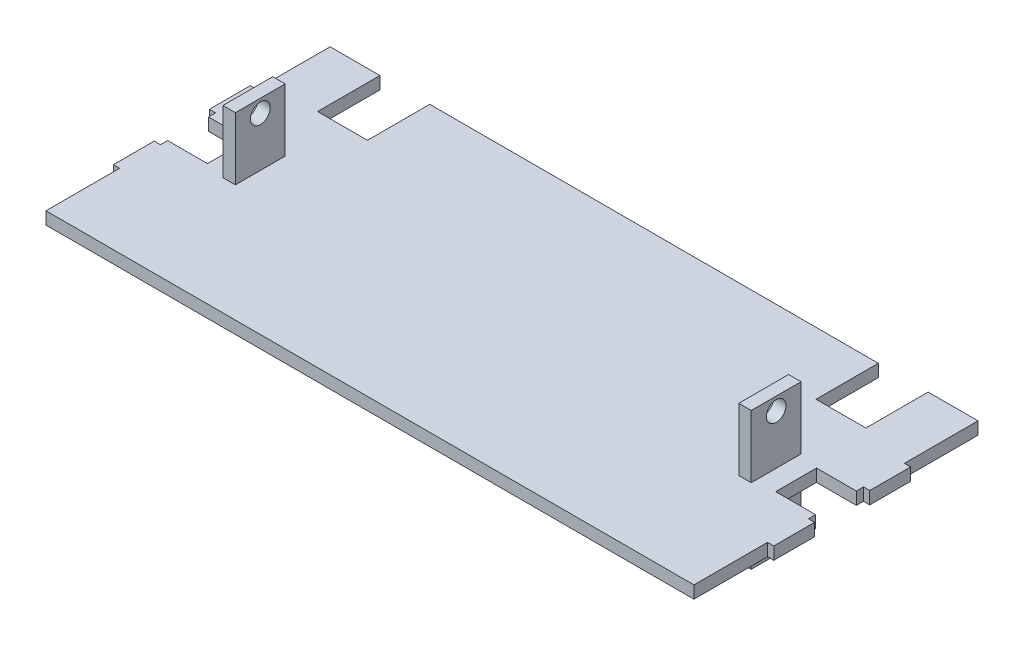
from build123d import *

# Parameters (mm, degrees)
BOSS_EXTRUDE1_DEPTH     = 3.175
SKETCH2_W               = 6.35
SKETCH2_H               = 25.4
BOSS_EXTRUDE2_DEPTH     = 35.052
CUT_EXTRUDE1_DEPTH      = 314.391665219
CUT_EXTRUDE1_DEPTH_BACK = 314.391665219
SKETCH3_R               = 5.0038


with BuildPart() as part:
    # Sketch1 → Boss-Extrude1 (new, symmetric)
    with BuildSketch(Plane(origin=(0, 0, 0), x_dir=(1, 0, 0), z_dir=(0, 1, 0))):
        Polygon((165.1, -72.39), (-165.1, -72.39), (-165.1, -34.874677354), (-168.275, -34.874677354), (-168.275, -14.046677354), (-165.1, -14.046677354), (-165.1, -10.414), (-144.78, -10.414), (-144.78, 10.414), (-165.1, 10.414), (-165.1, 14.046677354), (-168.275, 14.046677354), (-168.275, 34.874677354), (-165.1, 34.874677354), (-165.1, 72.39), (-139.7, 72.39), (-139.7, 40.64), (-114.3, 40.64), (-114.3, 72.39), (114.3, 72.39), (114.3, 40.64), (139.7, 40.64), (139.7, 72.39), (165.1, 72.39), (165.1, 34.874677354), (168.275, 34.874677354), (168.275, 14.046677354), (165.1, 14.046677354), (165.1, 10.414), (144.78, 10.414), (144.78, -10.414), (165.1, -10.414), (165.1, -14.046677354), (168.275, -14.046677354), (168.275, -34.874677354), (165.1, -34.874677354), align=None)
    extrude(amount=BOSS_EXTRUDE1_DEPTH, both=True)

    # Sketch2 → Boss-Extrude2 (add, symmetric)
    with BuildSketch(Plane(origin=(0, 0, 0), x_dir=(1, 0, 0), z_dir=(0, 1, 0))):
        with Locations((131.445, 0)):
            Rectangle(SKETCH2_W, SKETCH2_H)
        with Locations((-131.445, 0)):
            Rectangle(SKETCH2_W, SKETCH2_H)
    extrude(amount=BOSS_EXTRUDE2_DEPTH, both=True)

    # Sketch3 → Cut-Extrude1 (cut, two sides: drawn at the far end of the back side and taken through both)
    with BuildSketch(Plane.ZY.offset(134.62).offset(-CUT_EXTRUDE1_DEPTH_BACK)):
        with Locations((0, 28.440626924)):
            Circle(SKETCH3_R)
        with Locations((0, -28.440626924)):
            Circle(SKETCH3_R)
    extrude(amount=CUT_EXTRUDE1_DEPTH + CUT_EXTRUDE1_DEPTH_BACK, mode=Mode.SUBTRACT)


solid = part.part
